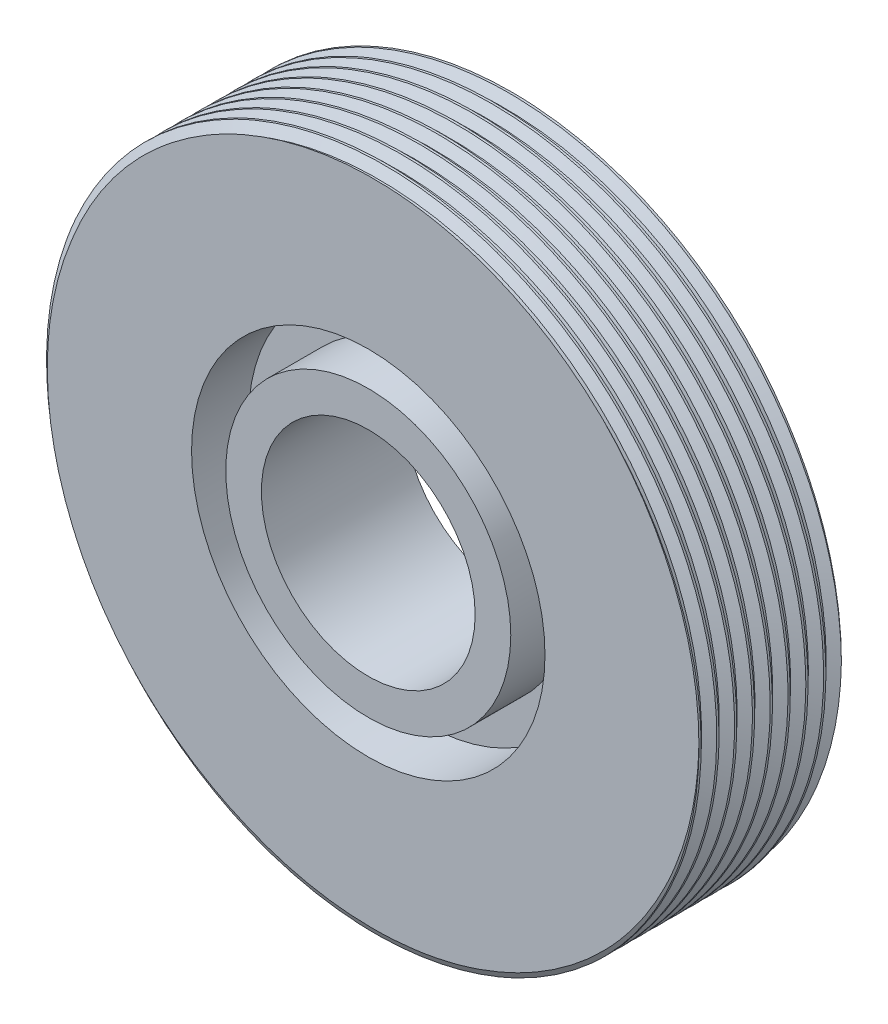
from build123d import *

# Parameters (mm, degrees)
SKETCH3_R           = 14.732
BOSS_EXTRUDE1_DEPTH = 6.35
SKETCH11_R          = 4.7625
CUT_EXTRUDE3_DEPTH  = 49.738932411
SKETCH12_R          = 7.874
SKETCH12_R_2        = 6.35
CUT_EXTRUDE4_DEPTH  = 2.54
THREAD1_PITCH       = 0.79375


with BuildPart() as part:
    # Sketch3 → Boss-Extrude1 (new body)
    with BuildSketch(Plane.XY):
        with Locations((8.347593151, 27.723781851)):
            Circle(SKETCH3_R)
    extrude(amount=-BOSS_EXTRUDE1_DEPTH)

    # Sketch11 → Cut-Extrude3 (cut, through all)
    with BuildSketch(Plane.XY):
        with Locations((8.347593151, 27.723781851)):
            Circle(SKETCH11_R)
    extrude(amount=-CUT_EXTRUDE3_DEPTH, mode=Mode.SUBTRACT)

    # Sketch12 → Cut-Extrude4 (cut)
    with BuildSketch(Plane.XY):
        with Locations((8.347593151, 27.723781851)):
            Circle(SKETCH12_R)
        with Locations((8.347593151, 27.723781851)):
            Circle(SKETCH12_R_2, mode=Mode.SUBTRACT)
    extrude(amount=-CUT_EXTRUDE4_DEPTH, mode=Mode.SUBTRACT)

    # Thread1: the profile of Thread Profile1 profile screwed along a right-hand helix of 9.6 turns, 8 arcs to a turn; built about Z, then put on its axis
    thread1_z = Axis((0, 0, 0), (0, 0, 1))
    thread1_corners = [(14.7323, 0, -0.000173205), (14.7323, 0, 0.694704453), (14.302370211, 0, 0.446484374), (14.302370211, 0, 0.248046874)]
    with BuildLine(mode=Mode.PRIVATE) as thread1_profile:
        Line(thread1_corners[0], thread1_corners[1])
        Line(thread1_corners[1], thread1_corners[2])
        Line(thread1_corners[2], thread1_corners[3])
        Line(thread1_corners[3], thread1_corners[0])
    thread1_cap = Face(thread1_profile.wire())
    thread1_turn_angles = [0, 22.5, 45, 67.5, 90, 112.5, 135, 157.5, 180, 202.5, 225, 247.5, 270, 292.5, 315, 337.5, 360]
    thread1_turn_weights = [1, 0.9238795325112867, 1, 0.9238795325112867, 1, 0.9238795325112867, 1, 0.9238795325112867, 1, 0.9238795325112867, 1, 0.9238795325112867, 1, 0.9238795325112867, 1, 0.9238795325112867, 1]
    thread1_turn_rails = [Edge.make_bspline([Vector(p[0], p[1], 0).rotate(thread1_z, thread1_turn_angles[k]) / thread1_turn_weights[k] + Vector(0, 0, p[2] + THREAD1_PITCH * thread1_turn_angles[k] / 360) for k in range(17)], [0, 0, 0, 1, 1, 2, 2, 3, 3, 4, 4, 5, 5, 6, 6, 7, 7, 8, 8, 8], 2, thread1_turn_weights) for p in thread1_corners]
    thread1_turn_sides = [Face.make_surface_from_curves(thread1_turn_rails[p[0]], thread1_turn_rails[p[1]]) for p in [(0, 1), (1, 2), (2, 3), (3, 0)]]
    thread1_last_angles = [3240, 3262.5, 3285, 3307.5, 3330, 3352.5, 3375, 3397.5, 3420, 3438, 3456]
    thread1_last_weights = [1, 0.9238795325112867, 1, 0.9238795325112867, 1, 0.9238795325112867, 1, 0.9238795325112867, 1, 0.9510565162951535, 1]
    thread1_last_rails = [Edge.make_bspline([Vector(p[0], p[1], 0).rotate(thread1_z, thread1_last_angles[k]) / thread1_last_weights[k] + Vector(0, 0, p[2] + THREAD1_PITCH * thread1_last_angles[k] / 360) for k in range(11)], [0, 0, 0, 1, 1, 2, 2, 3, 3, 4, 4, 5, 5, 5], 2, thread1_last_weights) for p in thread1_corners]
    thread1_last_sides = [Face.make_surface_from_curves(thread1_last_rails[p[0]], thread1_last_rails[p[1]]) for p in [(0, 1), (1, 2), (2, 3), (3, 0)]]
    thread1 = Plane(origin=(8.347593151, 27.723781851, -7.14375), x_dir=(1, 0, 0), z_dir=(0, 0, 1)) * Solid(Shell([*[p.moved(Location((0, 0, THREAD1_PITCH * i))) for i in range(9) for p in thread1_turn_sides], *thread1_last_sides, thread1_cap, thread1_cap.rotate(thread1_z, 3456).moved(Location((0, 0, THREAD1_PITCH * 3456 / 360)))]))
    add(thread1, mode=Mode.SUBTRACT)


solid = part.part
